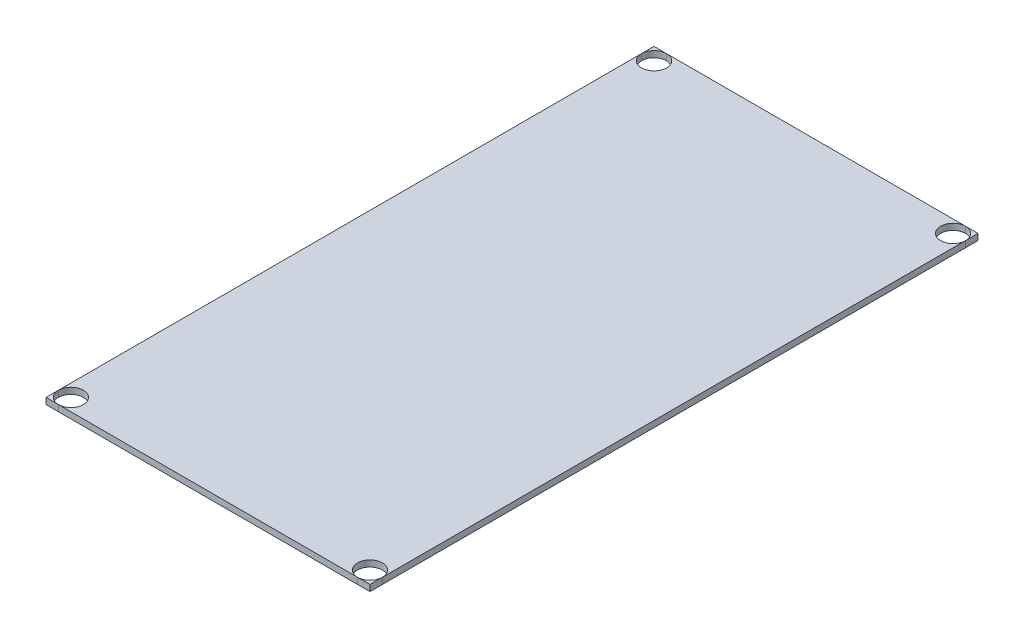
from build123d import *

# Parameters (mm, degrees)
BOSS_EXTRUDE1_DEPTH   = 6.35
BOSS_EXTRUDE1_2_DEPTH = 6.35
BOSS_EXTRUDE1_3_DEPTH = 6.35
BOSS_EXTRUDE1_4_DEPTH = 6.35
BOSS_EXTRUDE1_5_DEPTH = 6.35


with BuildPart() as part:
    # Sketch1 → Boss-Extrude1 (new body)
    with BuildSketch(Plane(origin=(0, -66.4972, 0), x_dir=(1, 0, 0), z_dir=(0, 1, 0))):
        with BuildLine():
            Line((-786.499999918, 617.414), (-799.199999918, 617.414))
            Line((-799.199999918, 617.414), (-799.199999918, 604.714))
            ThreePointArc((-799.199999918, 604.714), (-795.480256039, 613.694256121), (-786.499999918, 617.414))
        make_face()
    extrude(amount=BOSS_EXTRUDE1_DEPTH)


with BuildPart() as body_2:
    # Sketch1 → Boss-Extrude1 2 (new body)
    with BuildSketch(Plane(origin=(0, -66.4972, 0), x_dir=(1, 0, 0), z_dir=(0, 1, 0))):
        with BuildLine():
            Line((-481.699999918, 617.414), (-786.499999918, 617.414))
            ThreePointArc((-786.499999918, 617.414), (-777.519743797, 595.733743879), (-799.199999918, 604.714))
            Line((-799.199999918, 604.714), (-799.199999918, 10.41400003))
            ThreePointArc((-799.199999918, 10.41400003), (-777.519743786, 19.39425611), (-786.499999918, -2.286))
            Line((-786.499999918, -2.286), (-481.699999918, -2.286))
            ThreePointArc((-481.699999918, -2.286), (-490.680256039, 19.394256121), (-468.999999918, 10.414))
            Line((-468.999999918, 10.414), (-468.999999918, 604.714))
            ThreePointArc((-468.999999918, 604.714), (-490.680256039, 595.733743879), (-481.699999918, 617.414))
        make_face()
    extrude(amount=BOSS_EXTRUDE1_2_DEPTH)


with BuildPart() as body_3:
    # Sketch1 → Boss-Extrude1 3 (new body)
    with BuildSketch(Plane(origin=(0, -66.4972, 0), x_dir=(1, 0, 0), z_dir=(0, 1, 0))):
        with BuildLine():
            Line((-468.999999918, 617.414), (-481.699999918, 617.414))
            ThreePointArc((-481.699999918, 617.414), (-472.719743797, 613.694256121), (-468.999999918, 604.714))
            Line((-468.999999918, 604.714), (-468.999999918, 617.414))
        make_face()
    extrude(amount=BOSS_EXTRUDE1_3_DEPTH)


with BuildPart() as body_4:
    # Sketch1 → Boss-Extrude1 4 (new body)
    with BuildSketch(Plane(origin=(0, -66.4972, 0), x_dir=(1, 0, 0), z_dir=(0, 1, 0))):
        with BuildLine():
            ThreePointArc((-786.499999918, -2.286), (-795.48025605, 1.43374389), (-799.199999918, 10.41400003))
            Line((-799.199999918, 10.41400003), (-799.199999918, -2.286))
            Line((-799.199999918, -2.286), (-786.499999918, -2.286))
        make_face()
    extrude(amount=BOSS_EXTRUDE1_4_DEPTH)


with BuildPart() as body_5:
    # Sketch1 → Boss-Extrude1 5 (new body)
    with BuildSketch(Plane(origin=(0, -66.4972, 0), x_dir=(1, 0, 0), z_dir=(0, 1, 0))):
        with BuildLine():
            Line((-468.999999918, -2.286), (-468.999999918, 10.414))
            ThreePointArc((-468.999999918, 10.414), (-472.719743797, 1.433743879), (-481.699999918, -2.286))
            Line((-481.699999918, -2.286), (-468.999999918, -2.286))
        make_face()
    extrude(amount=BOSS_EXTRUDE1_5_DEPTH)


solid = Compound([part.part, body_2.part, body_3.part, body_4.part, body_5.part])
